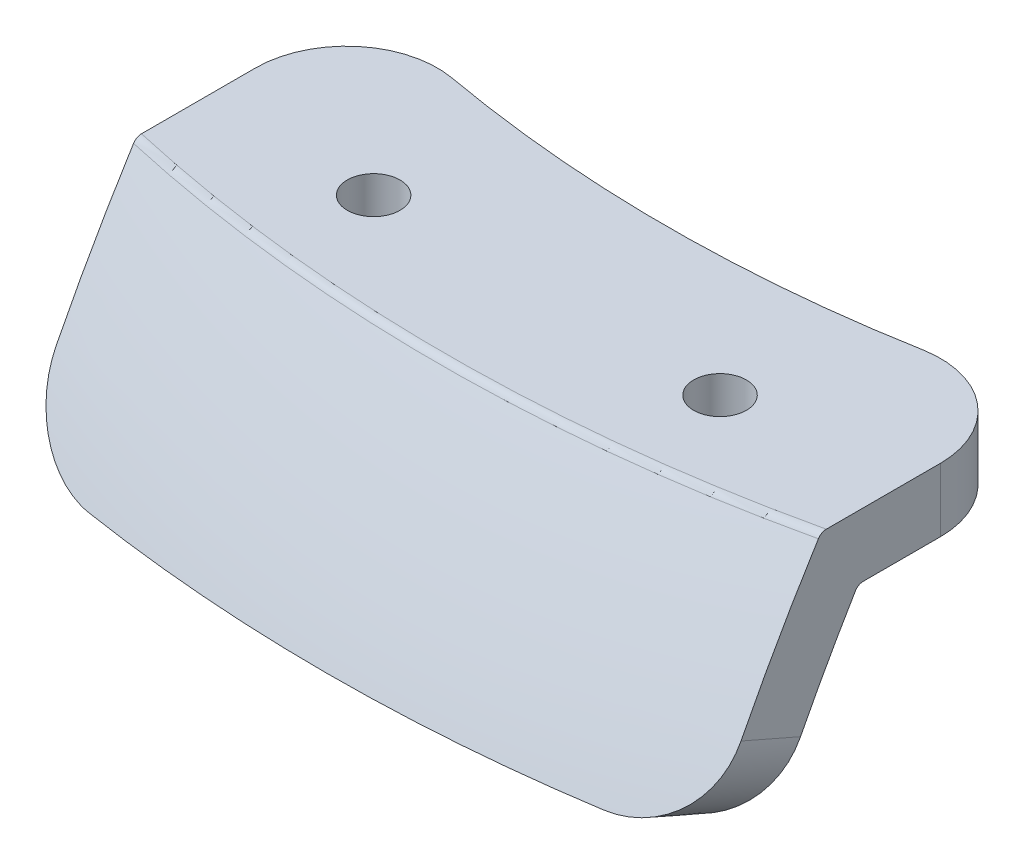
from build123d import *

# Parameters (mm, degrees)
REVOLVE1_ANGLE      = 30
SKETCH5_OUTSIDE_W   = 118.116
SKETCH5_OUTSIDE_H   = 65.786
SKETCH5_OUTSIDE_W_2 = 75.329921726
SKETCH5_OUTSIDE_H_2 = 42.362110511
CUT_EXTRUDE2_DEPTH  = 273.756230171
FILLET1_R           = 10
FILLET2_R           = 1
SKETCH6_R           = 2.9
CUT_EXTRUDE3_DEPTH  = 189.665890372


with BuildPart() as part:
    # Sketch1 → Revolve1 (revolve, symmetric)
    with BuildSketch(Plane(origin=(0, 0, 0), x_dir=(0, 0, -1), z_dir=(1, 0, 0))) as revolve1_sk:
        with BuildLine():
            Line((-182.929658118, 172.831710184), (-176.527920301, 170.000146495))
            ThreePointArc((-176.527920301, 170.000146495), (-171.7595902, 179.99527834), (-166.425900574, 189.700503093))
            Line((-166.425900574, 189.700503093), (-145.526233777, 189.700503093))
            Line((-145.526233777, 189.700503093), (-145.526233777, 196.700503093))
            Line((-145.526233777, 196.700503093), (-170.38485915, 196.700503093))
            ThreePointArc((-170.38485915, 196.700503093), (-177.059924452, 184.977737019), (-182.929658118, 172.831710184))
        make_face()
    revolve(axis=Axis((0, 0, 0), (0, 1, 0)), revolution_arc=REVOLVE1_ANGLE / 2)
    revolve(revolve1_sk.sketch, axis=Axis((0, 0, 0), (0, -1, 0)), revolution_arc=REVOLVE1_ANGLE / 2)

    # Sketch4 → Cut-Revolve1 (revolve, cut)
    with BuildSketch(Plane(origin=(0, 72.974433775, -37.182331171), x_dir=(0, 0.45399049973954475, 0.8910065241883689), z_dir=(0, -0.8910065241883689, 0.45399049973954475))):
        Polygon((219.749406501, 20.731311642), (239.017694648, 22.41706842), (239.148428262, 20.922776373), (219.880140115, 19.237019595), align=None)
    cut_revolve1 = revolve(axis=Axis((-19.237019595, 172.797928469, 158.732308211), (-0.08715574274765844, 0.4522629288245561, 0.887615975361608)), mode=Mode.SUBTRACT)

    # Mirror1: Cut-Revolve1 across plane
    add(cut_revolve1.mirror(Plane(origin=(0, 0, 0), x_dir=(0, 0, 1), z_dir=(1, 0, 0))), mode=Mode.SUBTRACT)

    # Sketch5 outside → Cut-Extrude2 (cut, through all)
    with BuildSketch(Plane(origin=(0, 0, 0), x_dir=(1, 0, 0), z_dir=(0, 1, 0))):
        with Locations((0, -161.749)):
            Rectangle(SKETCH5_OUTSIDE_W, SKETCH5_OUTSIDE_H)
        with Locations((0, -161.748602863)):
            Rectangle(SKETCH5_OUTSIDE_W_2, SKETCH5_OUTSIDE_H_2, mode=Mode.SUBTRACT)
    extrude(amount=CUT_EXTRUDE2_DEPTH, mode=Mode.SUBTRACT)

    # Fillet1
    fillet1_edges = [part.edges().sort_by_distance(p)[0] for p in [
        (-37.664960863, 193.200503093, 140.567547607),
        (37.664960863, 193.200503093, 140.567547607),
        (-37.664960863, 171.41544031, 175.736711543),
        (37.664960863, 171.41544031, 175.736711543),
    ]]
    fillet(fillet1_edges, radius=FILLET1_R)

    # Fillet2
    fillet2_edges = [part.edges().sort_by_distance(p)[0] for p in [
        (0, 196.700503093, 170.38485915),
        (0, 189.700503093, 166.425900574),
    ]]
    fillet(fillet2_edges, radius=FILLET2_R)

    # Sketch6 → Cut-Extrude3 (cut, through all)
    with BuildSketch(Plane(origin=(0, 196.700503093, 0), x_dir=(1, 0, 0), z_dir=(0, 1, 0))):
        with Locations((19.05, -158.674245572)):
            Circle(SKETCH6_R)
        with Locations((-19.05, -158.674245572)):
            Circle(SKETCH6_R)
    extrude(amount=-CUT_EXTRUDE3_DEPTH, mode=Mode.SUBTRACT)


solid = part.part
